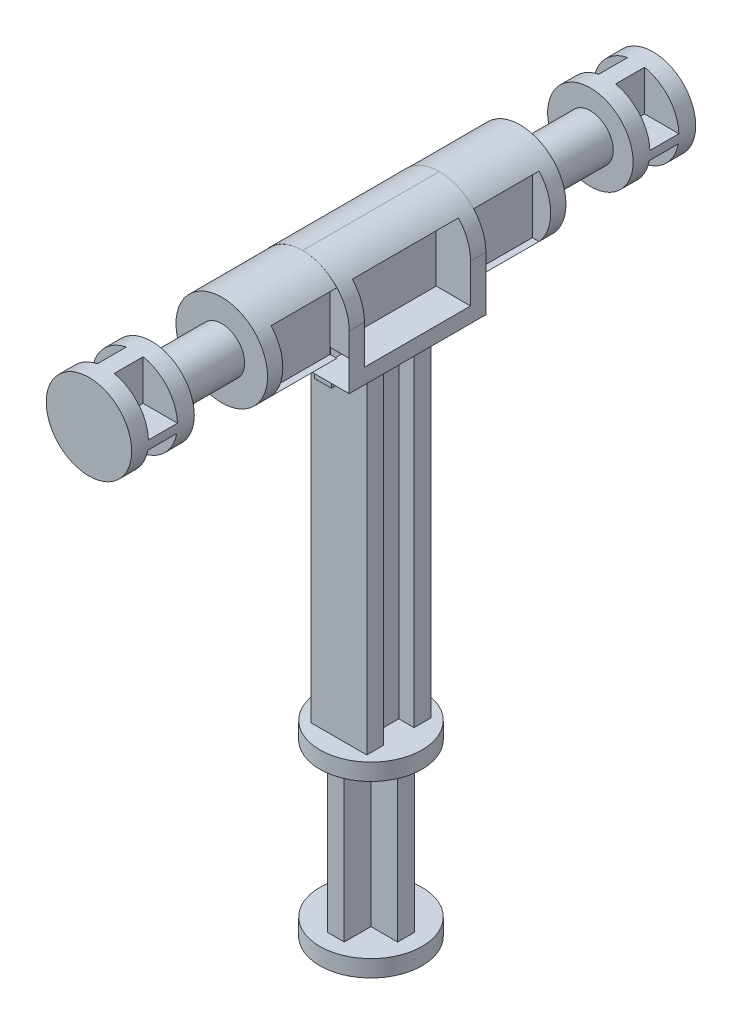
from build123d import *

# Parameters (mm, degrees)
SKETCH1_R                 = 3.35
BOSS_EXTRUDE1_DEPTH       = 1.1
BOSS_EXTRUDE2_DEPTH       = 10.05
SKETCH3_R                 = 3.35
BOSS_EXTRUDE3_DEPTH       = 1.1
BOSS_EXTRUDE4_DEPTH       = 22.3
SKETCH6_W                 = 6.1
SKETCH6_H                 = 8.95
BOSS_EXTRUDE5_DEPTH       = 6.6
SKETCH7_R                 = 3
BOSS_EXTRUDE6_DEPTH       = 5.3
SKETCH8_R                 = 1.5
BOSS_EXTRUDE7_DEPTH       = 4.6
SKETCH9_R                 = 2.8
BOSS_EXTRUDE8_DEPTH       = 4.1
FILLET2_R                 = 3.05
CUT_EXTRUDE1_START        = -2.25
SKETCH10_W                = 6.95
SKETCH10_H                = 4.6
CUT_EXTRUDE1_DEPTH        = 48.808842446
SKETCH11_W                = 4.3
SKETCH11_H                = 4
CUT_EXTRUDE2_DEPTH        = 1.25
SKETCH12_W                = 1.9
SKETCH12_H                = 2.702356958
SKETCH12_H_2              = 2.266123784
CUT_EXTRUDE3_DEPTH        = 2.5
MIRROR3_START             = -2.25
MIRROR3_COPY_1_SKETCH_W   = 6.95
MIRROR3_COPY_1_SKETCH_H   = 4.6
MIRROR3_COPY_1_DEPTH      = 48.808842446
MIRROR3_COPY_2_SKETCH_W   = 4.3
MIRROR3_COPY_2_SKETCH_H   = 4
MIRROR3_COPY_2_DEPTH      = 1.25
MIRROR3_COPY_3_SKETCH_W   = 1.9
MIRROR3_COPY_3_SKETCH_H   = 2.702356958
MIRROR3_COPY_3_SKETCH_H_2 = 2.266123784
MIRROR3_COPY_3_DEPTH      = 2.5
MIRROR3_COPY_4_SKETCH_W   = 6.95
MIRROR3_COPY_4_SKETCH_H   = 4.6
MIRROR3_COPY_4_DEPTH      = 48.808842446
SKETCH13_W                = 1.12
SKETCH13_H                = 1.6
BOSS_EXTRUDE9_DEPTH       = 3.15
SKETCH14_R                = 1.05
BOSS_EXTRUDE10_DEPTH      = 0.5
SKETCH15_R                = 1.2
BOSS_EXTRUDE11_DEPTH      = 0.5
CHAMFER1_SIZE             = 0.3


with BuildPart() as part:
    # Sketch1 → Boss-Extrude1 (new body)
    with BuildSketch(Plane(origin=(0, 0, 0), x_dir=(1, 0, 0), z_dir=(0, 1, 0))):
        with Locations(Location((0, 0, 0), (0, 0, 270))):
            Circle(SKETCH1_R)
    extrude(amount=BOSS_EXTRUDE1_DEPTH)

    # Sketch2 → Boss-Extrude2 (add)
    with BuildSketch(Plane(origin=(0, 1.1, 0), x_dir=(1, 0, 0), z_dir=(0, 1, 0))):
        Polygon((-0.55, -2.3), (0.55, -2.3), (0.55, -0.55), (2.3, -0.55), (2.3, 0.55), (0.55, 0.55), (0.55, 2.3), (-0.55, 2.3), (-0.55, 0.55), (-2.3, 0.55), (-2.3, -0.55), (-0.55, -0.55), align=None)
    extrude(amount=BOSS_EXTRUDE2_DEPTH)

    # Sketch3 → Boss-Extrude3 (add)
    with BuildSketch(Plane(origin=(0, 11.15, 0), x_dir=(1, 0, 0), z_dir=(0, 1, 0))):
        with Locations(Location((0, 0, 0), (0, 0, 270))):
            Circle(SKETCH3_R)
    extrude(amount=BOSS_EXTRUDE3_DEPTH)

    # Sketch5 → Boss-Extrude4 (add)
    with BuildSketch(Plane(origin=(0, 12.25, 0), x_dir=(1, 0, 0), z_dir=(0, 1, 0))):
        Polygon((-1.825, 1), (-1.825, 2.1), (1.825, 2.1), (1.825, 1), (0.825, 1), (0.825, -1), (1.825, -1), (1.825, -2.1), (-1.825, -2.1), (-1.825, -1), (-0.825, -1), (-0.825, 1), align=None)
    extrude(amount=BOSS_EXTRUDE4_DEPTH)

    # Sketch6 → Boss-Extrude5 (add)
    with BuildSketch(Plane(origin=(0, 34.55, 0), x_dir=(1, 0, 0), z_dir=(0, 1, 0))):
        Rectangle(SKETCH6_W, SKETCH6_H)
    extrude(amount=BOSS_EXTRUDE5_DEPTH)

    # Sketch7 → Boss-Extrude6 (add)
    with BuildSketch(Plane.XY.offset(4.475)):
        with Locations(Location((0, 38.15, 0), (0, 0, 90))):
            Circle(SKETCH7_R)
    boss_extrude6 = extrude(amount=BOSS_EXTRUDE6_DEPTH)

    # Sketch8 → Boss-Extrude7 (add)
    with BuildSketch(Plane.XY.offset(9.775)):
        with Locations((0, 38.15)):
            Circle(SKETCH8_R)
    boss_extrude7 = extrude(amount=BOSS_EXTRUDE7_DEPTH)

    # Sketch9 → Boss-Extrude8 (add)
    with BuildSketch(Plane.XY.offset(14.375)):
        with Locations((0, 38.15)):
            Circle(SKETCH9_R)
    boss_extrude8 = extrude(amount=BOSS_EXTRUDE8_DEPTH)

    # Fillet2
    fillet2_edges = [part.edges().sort_by_distance(p)[0] for p in [
        (3.05, 41.15, 0),
        (-3.05, 41.15, 0),
    ]]
    fillet(fillet2_edges, radius=FILLET2_R - 0.0001)  # a hair under: the kernel refuses the full size

    # Sketch10 → Cut-Extrude1 (cut)
    with BuildSketch(Plane.ZY.offset(3.05).offset(CUT_EXTRUDE1_START)):
        with Locations((0, 37.85)):
            Rectangle(SKETCH10_W, SKETCH10_H)
    cut_extrude1 = extrude(amount=CUT_EXTRUDE1_DEPTH, mode=Mode.SUBTRACT)

    # Sketch11 → Cut-Extrude2 (cut)
    with BuildSketch(Plane.ZY.offset(3.05)):
        with Locations((6.625, 38.15)):
            Rectangle(SKETCH11_W, SKETCH11_H)
    cut_extrude2 = extrude(amount=-CUT_EXTRUDE2_DEPTH, mode=Mode.SUBTRACT)

    # Sketch12 → Cut-Extrude3 (cut)
    with BuildSketch(Plane.ZY.offset(3.05)):
        with Locations((16.425, 39.598821521)):
            Rectangle(SKETCH12_W, SKETCH12_H)
        with Locations((16.425, 36.510916585)):
            Rectangle(SKETCH12_W, SKETCH12_H_2)
    cut_extrude3 = extrude(amount=-CUT_EXTRUDE3_DEPTH, mode=Mode.SUBTRACT)

    # Mirror1: Cut-Extrude1, Cut-Extrude2, Cut-Extrude3 across plane
    add(cut_extrude1.mirror(Plane(origin=(0, 0, 0), x_dir=(0, 0, 1), z_dir=(1, 0, 0))), mode=Mode.SUBTRACT)
    add(cut_extrude2.mirror(Plane(origin=(0, 0, 0), x_dir=(0, 0, 1), z_dir=(1, 0, 0))), mode=Mode.SUBTRACT)
    add(cut_extrude3.mirror(Plane(origin=(0, 0, 0), x_dir=(0, 0, 1), z_dir=(1, 0, 0))), mode=Mode.SUBTRACT)

    # Mirror3: Boss-Extrude6, Boss-Extrude7, Boss-Extrude8, Cut-Extrude2, Cut-Extrude3 across plane
    add(boss_extrude6.mirror(Plane.XY))
    add(boss_extrude7.mirror(Plane.XY))
    add(boss_extrude8.mirror(Plane.XY))
    add(cut_extrude2.mirror(Plane.XY), mode=Mode.SUBTRACT)
    add(cut_extrude3.mirror(Plane.XY), mode=Mode.SUBTRACT)

    # Mirror3 copy 1 sketch → Mirror3 copy 1 (cut)
    with BuildSketch(Plane(origin=(3.05, 0, 0), x_dir=(0, 0, -1), z_dir=(1, 0, 0)).offset(MIRROR3_START)):
        with Locations((0, 37.85)):
            Rectangle(MIRROR3_COPY_1_SKETCH_W, MIRROR3_COPY_1_SKETCH_H)
    extrude(amount=MIRROR3_COPY_1_DEPTH, mode=Mode.SUBTRACT)

    # Mirror3 copy 2 sketch → Mirror3 copy 2 (cut)
    with BuildSketch(Plane(origin=(3.05, 0, 0), x_dir=(0, 0, -1), z_dir=(1, 0, 0))):
        with Locations((6.625, 38.15)):
            Rectangle(MIRROR3_COPY_2_SKETCH_W, MIRROR3_COPY_2_SKETCH_H)
    extrude(amount=-MIRROR3_COPY_2_DEPTH, mode=Mode.SUBTRACT)

    # Mirror3 copy 3 sketch → Mirror3 copy 3 (cut)
    with BuildSketch(Plane(origin=(3.05, 0, 0), x_dir=(0, 0, -1), z_dir=(1, 0, 0))):
        with Locations((16.425, 39.598821521)):
            Rectangle(MIRROR3_COPY_3_SKETCH_W, MIRROR3_COPY_3_SKETCH_H)
        with Locations((16.425, 36.510916585)):
            Rectangle(MIRROR3_COPY_3_SKETCH_W, MIRROR3_COPY_3_SKETCH_H_2)
    extrude(amount=-MIRROR3_COPY_3_DEPTH, mode=Mode.SUBTRACT)

    # Mirror3 copy 4 sketch → Mirror3 copy 4 (cut)
    with BuildSketch(Plane(origin=(-3.05, 0, 0), x_dir=(0, 0, -1), z_dir=(-1, 0, 0)).offset(MIRROR3_START)):
        with Locations((0, -37.85)):
            Rectangle(MIRROR3_COPY_4_SKETCH_W, MIRROR3_COPY_4_SKETCH_H)
    extrude(amount=MIRROR3_COPY_4_DEPTH, mode=Mode.SUBTRACT)

    # Sketch13 → Boss-Extrude9 (add, symmetric)
    with BuildSketch(Plane.XY):
        with Locations((0, 33.75)):
            Rectangle(SKETCH13_W, SKETCH13_H)
    extrude(amount=BOSS_EXTRUDE9_DEPTH, both=True)

    # Sketch14 → Boss-Extrude10 (add, symmetric)
    with BuildSketch(Plane.XZ):
        with Locations(Location((0, 0, 0), (0, 0, 90))):
            Circle(SKETCH14_R)
    extrude(amount=BOSS_EXTRUDE10_DEPTH, both=True)

    # Sketch15 → Boss-Extrude11 (add, symmetric)
    with BuildSketch(Plane.XZ.offset(0.5)):
        with Locations(Location((0, 0, 0), (0, 0, 90))):
            Circle(SKETCH15_R)
    extrude(amount=BOSS_EXTRUDE11_DEPTH, both=True)

    # Chamfer1
    chamfer1_edges = [part.edges().sort_by_distance(p)[0] for p in [
        (0, -1, -1.2),
    ]]
    chamfer(chamfer1_edges, length=CHAMFER1_SIZE)


solid = part.part
